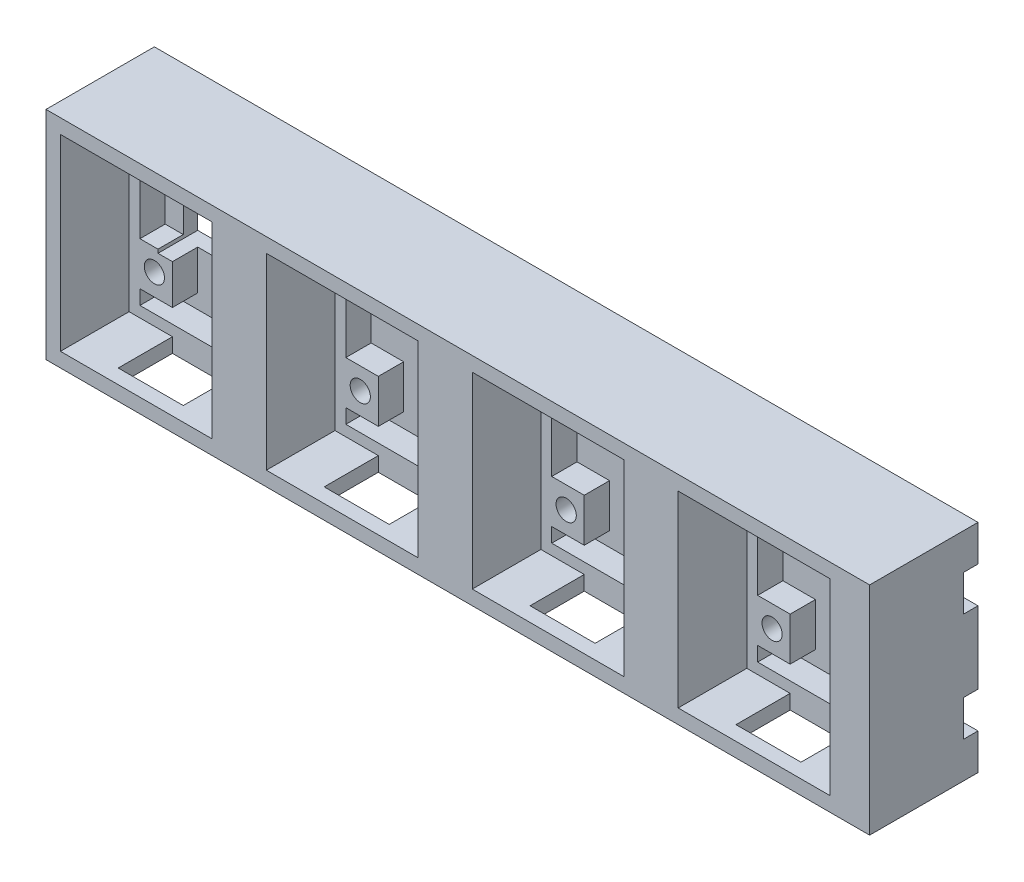
from build123d import *

# Parameters (mm, degrees)
SKETCH_1_W          = 114
SKETCH_1_H          = 30
EXTRUDE_1_DEPTH     = 15
SKETCH_2_W          = 21
SKETCH_2_H          = 26
CUT_EXTRUDE_1_DEPTH = 13
SKETCH_3_W          = 21
SKETCH_3_H          = 26
SKETCH_3_W_2        = 18
SKETCH_3_H_2        = 23
EXTRUDE_2_DEPTH     = 3.5
SKETCH_5_W          = 4.5
SKETCH_5_H          = 6
EXTRUDE_3_DEPTH     = 3.5
SKETCH_6_R          = 1.4
CUT_EXTRUDE_2_DEPTH = 94.726889515
SKETCH_7_W          = 9
SKETCH_7_H          = 7.5
CUT_EXTRUDE_3_DEPTH = 90.714734825
SKETCH_12_W         = 2
SKETCH_12_H         = 5
CUT_EXTRUDE_4_DEPTH = 3.5
SKETCH_13_W         = 8
SKETCH_13_H         = 8
CUT_EXTRUDE_5_DEPTH = 10


with BuildPart() as part:
    # ｽｹｯﾁ1 → ﾎﾞｽ - 押し出し1 (new body)
    with BuildSketch(Plane.XY):
        with Locations((-26.90312059, 25.678571429)):
            Rectangle(SKETCH_1_W, SKETCH_1_H)
    extrude(amount=EXTRUDE_1_DEPTH)

    # ｽｹｯﾁ2 → ｶｯﾄ - 押し出し1 (cut)
    with BuildSketch(Plane.XY.offset(15)):
        with Locations((-71.40312059, 25.678571429)):
            Rectangle(SKETCH_2_W, SKETCH_2_H)
        with Locations((-42.90312059, 25.678571429)):
            Rectangle(SKETCH_2_W, SKETCH_2_H)
        with Locations((-14.40312059, 25.678571429)):
            Rectangle(SKETCH_2_W, SKETCH_2_H)
        with Locations((14.09687941, 25.678571429)):
            Rectangle(SKETCH_2_W, SKETCH_2_H)
    extrude(amount=-CUT_EXTRUDE_1_DEPTH, mode=Mode.SUBTRACT)

    # ｽｹｯﾁ3 → ﾎﾞｽ - 押し出し2 (add)
    # profile 1 of 4: a face of its own
    with BuildSketch(Plane.XY.offset(2)):
        with Locations((-71.40312059, 25.678571429)):
            Rectangle(SKETCH_3_W, SKETCH_3_H)
        with Locations((-71.40312059, 25.678571429)):
            Rectangle(SKETCH_3_W_2, SKETCH_3_H_2, mode=Mode.SUBTRACT)
    # profile 2 of 4: a face of its own
    with BuildSketch(Plane.XY.offset(2)):
        with Locations((-42.90312059, 25.678571429)):
            Rectangle(SKETCH_3_W, SKETCH_3_H)
        with Locations((-42.90312059, 25.678571429)):
            Rectangle(SKETCH_3_W_2, SKETCH_3_H_2, mode=Mode.SUBTRACT)
    # profile 3 of 4: a face of its own
    with BuildSketch(Plane.XY.offset(2)):
        with Locations((-14.40312059, 25.678571429)):
            Rectangle(SKETCH_3_W, SKETCH_3_H)
        with Locations((-14.40312059, 25.678571429)):
            Rectangle(SKETCH_3_W_2, SKETCH_3_H_2, mode=Mode.SUBTRACT)
    # profile 4 of 4: a face of its own
    with BuildSketch(Plane.XY.offset(2)):
        with Locations((14.09687941, 25.678571429)):
            Rectangle(SKETCH_3_W, SKETCH_3_H)
        with Locations((14.09687941, 25.678571429)):
            Rectangle(SKETCH_3_W_2, SKETCH_3_H_2, mode=Mode.SUBTRACT)
    extrude(amount=EXTRUDE_2_DEPTH)

    # ｽｹｯﾁ5 → ﾎﾞｽ - 押し出し3 (add)
    with BuildSketch(Plane.XY.offset(2)):
        with Locations((-64.65312059, 19.178571429)):
            Rectangle(SKETCH_5_W, SKETCH_5_H)
        with Locations((-78.15312059, 19.178571429)):
            Rectangle(SKETCH_5_W, SKETCH_5_H)
        with Locations((-49.65312059, 19.178571429)):
            Rectangle(SKETCH_5_W, SKETCH_5_H)
        with Locations((-36.15312059, 19.178571429)):
            Rectangle(SKETCH_5_W, SKETCH_5_H)
        with Locations((-21.15312059, 19.178571429)):
            Rectangle(SKETCH_5_W, SKETCH_5_H)
        with Locations((-7.65312059, 19.178571429)):
            Rectangle(SKETCH_5_W, SKETCH_5_H)
        with Locations((7.34687941, 19.178571429)):
            Rectangle(SKETCH_5_W, SKETCH_5_H)
        with Locations((20.84687941, 19.178571429)):
            Rectangle(SKETCH_5_W, SKETCH_5_H)
    extrude(amount=EXTRUDE_3_DEPTH)

    # ｽｹｯﾁ6 → ｶｯﾄ - 押し出し2 (cut, through all)
    with BuildSketch(Plane.XY.offset(5.5)):
        with Locations((-64.40312059, 19.178571429)):
            Circle(SKETCH_6_R)
        with Locations((-78.40312059, 19.178571429)):
            Circle(SKETCH_6_R)
        with Locations((-49.90312059, 19.178571429)):
            Circle(SKETCH_6_R)
        with Locations((-35.90312059, 19.178571429)):
            Circle(SKETCH_6_R)
        with Locations((-21.40312059, 19.178571429)):
            Circle(SKETCH_6_R)
        with Locations((-7.40312059, 19.178571429)):
            Circle(SKETCH_6_R)
        with Locations((7.09687941, 19.178571429)):
            Circle(SKETCH_6_R)
        with Locations((21.09687941, 19.178571429)):
            Circle(SKETCH_6_R)
    extrude(amount=-CUT_EXTRUDE_2_DEPTH, mode=Mode.SUBTRACT)

    # ｽｹｯﾁ7 → ｶｯﾄ - 押し出し3 (cut, through all)
    with BuildSketch(Plane(origin=(0, 12.678571429, 0), x_dir=(1, 0, 0), z_dir=(0, 1, 0))):
        with Locations((-71.40312059, -9.25)):
            Rectangle(SKETCH_7_W, SKETCH_7_H)
        with Locations((-42.90312059, -9.25)):
            Rectangle(SKETCH_7_W, SKETCH_7_H)
        with Locations((-14.40312059, -9.25)):
            Rectangle(SKETCH_7_W, SKETCH_7_H)
        with Locations((14.09687941, -9.25)):
            Rectangle(SKETCH_7_W, SKETCH_7_H)
    extrude(amount=-CUT_EXTRUDE_3_DEPTH, mode=Mode.SUBTRACT)

    # ｽｹｯﾁ12 → ｶｯﾄ - 押し出し4 (cut)
    with BuildSketch(Plane(origin=(30.09687941, 0, 0), x_dir=(0, 0, -1), z_dir=(1, 0, 0))):
        with Locations((-1, 18.178571429)):
            Rectangle(SKETCH_12_W, SKETCH_12_H)
        with Locations((-1, 33.178571429)):
            Rectangle(SKETCH_12_W, SKETCH_12_H)
    extrude(amount=-CUT_EXTRUDE_4_DEPTH, mode=Mode.SUBTRACT)

    # ｽｹｯﾁ13 → ｶｯﾄ - 押し出し5 (cut)
    with BuildSketch(Plane(origin=(0, 0, 0), x_dir=(-1, 0, 0), z_dir=(0, 0, -1))):
        with Locations((73.90312059, 25.678571429)):
            Rectangle(SKETCH_13_W, SKETCH_13_H)
    extrude(amount=-CUT_EXTRUDE_5_DEPTH, mode=Mode.SUBTRACT)


solid = part.part
